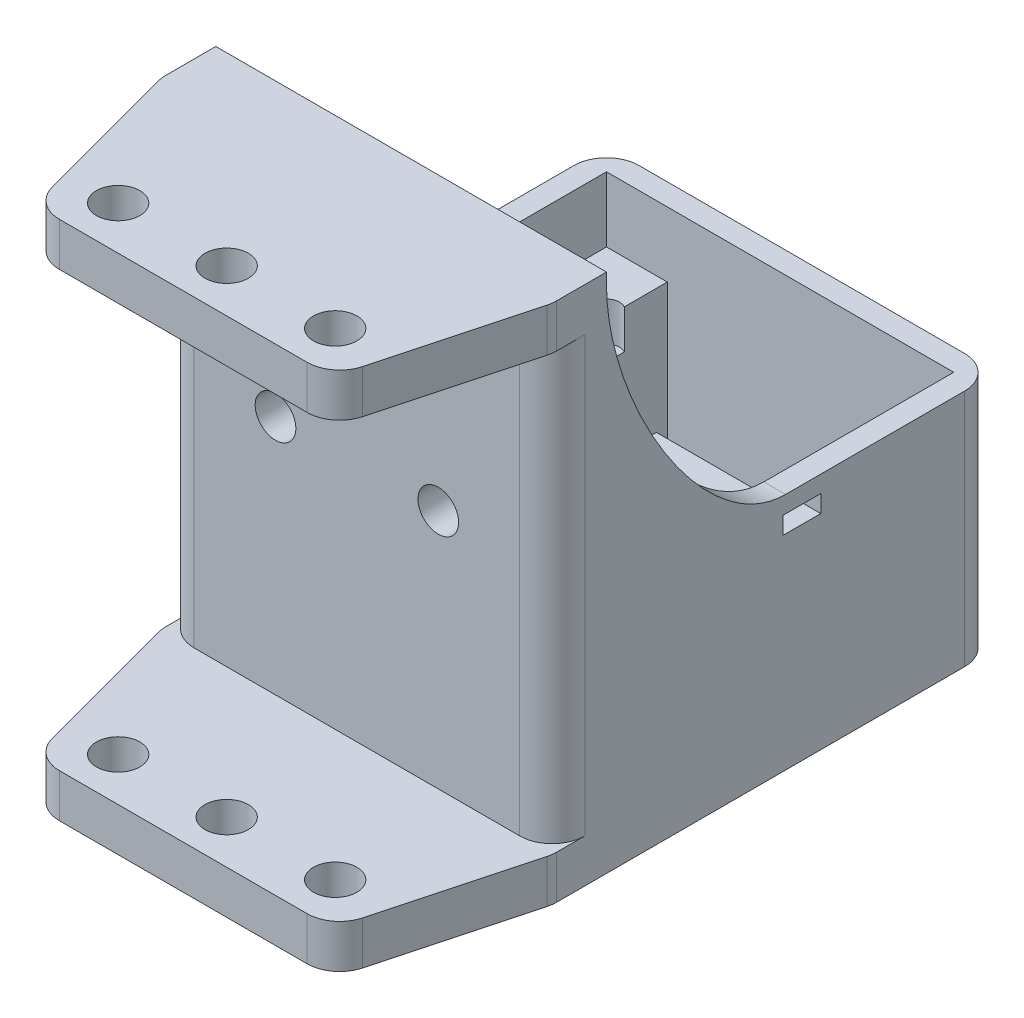
from build123d import *

# Parameters (mm, degrees)
SKETCH1_W           = 40.64
SKETCH1_H           = 40.64
BOSS_EXTRUDE1_DEPTH = 25.4
SHELL1_T            = 2.54
SKETCH2_W           = 7.112
SKETCH2_H           = 7.112
BOSS_EXTRUDE2_DEPTH = 17.78
BOSS_EXTRUDE3_DEPTH = 60.96
SKETCH5_W           = 20.32
SKETCH5_H           = 50.8
CUT_EXTRUDE1_DEPTH  = 90.198854813
SKETCH6_R           = 2.54
CUT_EXTRUDE2_DEPTH  = 82.804169209
FILLET1_R           = 3.81
SKETCH10_R          = 1.524
CUT_EXTRUDE4_DEPTH  = 4.572
CIRPATTERN1_COUNT   = 4
SKETCH11_R          = 7.3025
CUT_EXTRUDE5_DEPTH  = 80.929324406
RIB1_START          = -2.54
RIB1_DEPTH          = 2.54
SKETCH19_R          = 2.38125
CUT_EXTRUDE6_DEPTH  = 78.625990598
SKETCH20_W          = 2.032
SKETCH20_H          = 4.445
SKETCH7_W           = 38.1
SKETCH7_H           = 38.1
BOSS_EXTRUDE4_DEPTH = 3.175


with BuildPart() as part:
    # Sketch1 → Boss-Extrude1 (new body)
    with BuildSketch(Plane(origin=(0, 0, 0), x_dir=(1, 0, 0), z_dir=(0, 1, 0))):
        Rectangle(SKETCH1_W, SKETCH1_H)
    extrude(amount=BOSS_EXTRUDE1_DEPTH)

    # Shell1
    shell1_openings = [part.faces().sort_by_distance(p)[0] for p in [
        (0, 25.4, 0),
    ]]
    offset(amount=SHELL1_T, openings=shell1_openings, kind=Kind.INTERSECTION)

    # Sketch2 → Boss-Extrude2 (add)
    with BuildSketch(Plane(origin=(0, 0, 0), x_dir=(1, 0, 0), z_dir=(0, 1, 0))):
        with Locations((-16.764, 16.764)):
            Rectangle(SKETCH2_W, SKETCH2_H)
    boss_extrude2 = extrude(amount=BOSS_EXTRUDE2_DEPTH)

    # Sketch3 → Boss-Extrude3 (add)
    with BuildSketch(Plane.XZ.offset(2.54)):
        with BuildLine():
            Line((-22.730177398, 29.694504546), (-17.41527241, 49.53))
            Line((-17.41527241, 49.53), (17.41527241, 49.53))
            Line((17.41527241, 49.53), (22.730177398, 29.694504546))
            ThreePointArc((22.730177398, 29.694504546), (22.827404922, 29.205708777), (22.86, 28.708403984))
            Line((22.86, 28.708403984), (22.86, 22.86))
            Line((22.86, 22.86), (-22.86, 22.86))
            Line((-22.86, 22.86), (-22.86, 28.708403984))
            ThreePointArc((-22.86, 28.708403984), (-22.827404922, 29.205708777), (-22.730177398, 29.694504546))
        make_face()
    extrude(amount=-BOSS_EXTRUDE3_DEPTH)

    # Sketch5 → Cut-Extrude1 (cut, through all)
    with BuildSketch(Plane.ZY.offset(22.86)):
        with Locations((39.37, 27.94)):
            Rectangle(SKETCH5_W, SKETCH5_H)
    extrude(amount=-CUT_EXTRUDE1_DEPTH, mode=Mode.SUBTRACT)

    # Sketch6 → Cut-Extrude2 (cut, through all)
    with BuildSketch(Plane(origin=(0, 58.42, 0), x_dir=(1, 0, 0), z_dir=(0, 1, 0))):
        with Locations(Location((-12.7, -44.45, 0), (0, 0, 270))):
            Circle(SKETCH6_R)
        with Locations(Location((0, -44.45, 0), (0, 0, 270))):
            Circle(SKETCH6_R)
        with Locations(Location((12.7, -44.45, 0), (0, 0, 270))):
            Circle(SKETCH6_R)
    extrude(amount=-CUT_EXTRUDE2_DEPTH, mode=Mode.SUBTRACT)

    # Fillet1
    # the kernel refuses this fillet: 3.81 mm, written as the material it takes off along each edge
    with BuildSketch(Plane(origin=(-17.41527241, 46.03121044, 49.53), x_dir=(-0.25881904510252424, 0, -0.9659258262890673), z_dir=(0, 1, 0)), Plane(origin=(17.41527241, 46.03121044, 49.53), x_dir=(-1, 0, 0), z_dir=(0, 1, 0)), Plane(origin=(-17.41527241, -9.84878956, 49.53), x_dir=(-0.25881904510252424, 0, -0.9659258262890673), z_dir=(0, 1, 0)), Plane(origin=(17.41527241, -9.84878956, 49.53), x_dir=(-1, 0, 0), z_dir=(0, 1, 0))) as fillet1_piece_1:
        with BuildLine():
            CenterArc((FILLET1_R * 0.767326987979, -FILLET1_R), FILLET1_R, 90, 75)
            Line((-FILLET1_R * 0.19859883831, -FILLET1_R * 0.741180954897), (0, 0))
            Line((0, 0), (FILLET1_R * 0.767326987979, 0))
        make_face()
    extrude(amount=19.697579121, mode=Mode.SUBTRACT)
    with BuildSketch(Plane(origin=(-22.826837491, 53.34, 29.21), x_dir=(-0.008703740786851863, 0, -0.999962121730776), z_dir=(0, -1, 0))) as fillet1_piece_2:
        with BuildLine():
            CenterArc((3.776983069, 3.809855684), FILLET1_R, 180.49869391, 90)
            Line((-0.032872615, 3.776694431), (-0.413858183, 3.773378306))
            Line((-0.413858183, 3.773378306), (-0.380985568, -0.003316125))
            Line((-0.380985568, -0.003316125), (-0.04687044, -0.378106019))
            ThreePointArc((-0.04687044, -0.378106019), (0.505181779, -0.409781059), (3.813460447, -0.380985568))
            Line((3.813460447, -0.380985568), (3.810144322, 0))
        make_face()
    extrude(amount=50.8, mode=Mode.SUBTRACT)
    with BuildSketch(Plane(origin=(22.826837491, 53.34, 29.21), x_dir=(0.008703740786853719, 0, -0.999962121730776), z_dir=(0, -1, 0))) as fillet1_piece_3:
        with BuildLine():
            CenterArc((3.776983069, -3.809855684), FILLET1_R, 89.50130609, 90)
            Line((-0.032872615, -3.776694431), (-0.413858183, -3.773378306))
            Line((-0.413858183, -3.773378306), (-0.380985568, 0.003316125))
            Line((-0.380985568, 0.003316125), (-0.04687044, 0.378106019))
            ThreePointArc((-0.04687044, 0.378106019), (0.505181779, 0.409781059), (3.813460447, 0.380985568))
            Line((3.813460447, 0.380985568), (3.810144322, 0))
        make_face()
    extrude(amount=50.8, mode=Mode.SUBTRACT)
    with BuildSketch(Plane(origin=(-22.86, -12.065, -22.86), x_dir=(1, 0, 0), z_dir=(0, 1, 0))) as fillet1_piece_4:
        with BuildLine():
            CenterArc((FILLET1_R, -FILLET1_R), FILLET1_R, 90, 90)
            Line((0, -FILLET1_R), (0, 0))
            Line((0, 0), (FILLET1_R, 0))
        make_face()
    extrude(amount=46.99, mode=Mode.SUBTRACT)
    with BuildSketch(Plane(origin=(22.86, -12.065, -22.86), x_dir=(-1, 0, 0), z_dir=(0, 1, 0))) as fillet1_piece_5:
        with BuildLine():
            CenterArc((FILLET1_R, FILLET1_R), FILLET1_R, 180, 90)
            Line((0, FILLET1_R), (0, 0))
            Line((0, 0), (FILLET1_R, 0))
        make_face()
    extrude(amount=46.99, mode=Mode.SUBTRACT)

    # Sketch10 → Cut-Extrude4 (cut)
    with BuildSketch(Plane.XZ.offset(-13.208)):
        with Locations((-13.97, -13.97)):
            Circle(SKETCH10_R)
    cut_extrude4 = extrude(amount=-CUT_EXTRUDE4_DEPTH, mode=Mode.SUBTRACT)

    # CirPattern1: Boss-Extrude2, Cut-Extrude4 ×4 about axis
    cirpattern1_axis = Axis((0, 0, 0), (0, 1, 0))
    add([boss_extrude2.rotate(cirpattern1_axis, i * 360 / CIRPATTERN1_COUNT) for i in range(1, CIRPATTERN1_COUNT)])
    add([cut_extrude4.rotate(cirpattern1_axis, i * 360 / CIRPATTERN1_COUNT) for i in range(1, CIRPATTERN1_COUNT)], mode=Mode.SUBTRACT)

    # Sketch11 → Cut-Extrude5 (cut, through all)
    with BuildSketch(Plane(origin=(0, 0, 0), x_dir=(1, 0, 0), z_dir=(0, 1, 0))):
        with Locations(Location((0, 0, 0), (0, 0, 270))):
            Circle(SKETCH11_R)
    extrude(amount=-CUT_EXTRUDE5_DEPTH, mode=Mode.SUBTRACT)

    # Sketch12 → Revolve1 (revolve)
    with BuildSketch(Plane.XY, mode=Mode.PRIVATE) as revolve1_sk:
        Polygon((-11.1125, -2.54), (-11.1125, -5.08), (-7.3025, -2.54), align=None)
    revolve(revolve1_sk.sketch.rotate(Axis((0, 12.66825, 0), (0, -1, 0)), 270), axis=Axis((0, 12.66825, 0), (0, -1, 0)))

    # Rib1: read off the stored shape, not the designer's step
    # Rib1 outline → Rib1 (add)
    with BuildSketch(Plane.ZY.offset(22.86).offset(RIB1_START)):
        with BuildLine():
            add(Edge.make_bspline(
                [(1.905, 25.4), (11.363397975, 25.4), (22.86, 44.45), (22.86, 57.15)],
                knots=[0, 0, 0, 0, 1, 1, 1, 1], degree=3))
            Line((1.905, 25.4), (22.86, 25.4))
            Line((22.86, 25.4), (22.86, 57.15))
        make_face()
    rib1 = extrude(amount=RIB1_DEPTH)

    # Mirror2: Rib1 across plane
    add(rib1.mirror(Plane(origin=(0, 0, 0), x_dir=(0, 0, 1), z_dir=(1, 0, 0))))

    # Sketch19 → Cut-Extrude6 (cut, through all)
    with BuildSketch(Plane(origin=(0, 0, 22.86), x_dir=(-1, 0, 0), z_dir=(0, 0, -1))):
        with Locations((-9.525, 30.734)):
            Circle(SKETCH19_R)
        with Locations((9.525, 30.734)):
            Circle(SKETCH19_R)
        with Locations((0, 47.231783942)):
            Circle(SKETCH19_R)
    extrude(amount=-CUT_EXTRUDE6_DEPTH, mode=Mode.SUBTRACT)

    # Cut-Sweep1: sweep along a path in Sketch21
    with BuildLine() as cut_sweep1_path:  # in the path sketch's own coordinates; laid on its plane below (add() does not lay a ready-made edge on the line's plane)
        Line((-22.86, 22.4155), (-19.05, 22.4155))
        add(Edge.make_bspline(
            [(-19.05, 22.4155), (-16.933333333, 22.4155), (-15.24, 23.791333333), (-15.24, 25.273)],
            knots=[0, 0, 0, 0, 1, 1, 1, 1], degree=3))
    # Sketch20 → Cut-Sweep1 (sweep, cut)
    with BuildSketch(Plane(origin=(0, 25.273, 0), x_dir=(1, 0, 0), z_dir=(0, 1, 0))):
        with Locations((-15.24, 0)):
            Rectangle(SKETCH20_W, SKETCH20_H)
    cut_sweep1 = sweep(path=Plane.XY * cut_sweep1_path.line, mode=Mode.SUBTRACT)

    # Mirror4: Cut-Sweep1 across plane
    add(cut_sweep1.mirror(Plane(origin=(0, 0, 0), x_dir=(0, 0, 1), z_dir=(1, 0, 0))), mode=Mode.SUBTRACT)


with BuildPart() as body_2:
    # Sketch7 → Boss-Extrude4 (new body)
    with BuildSketch(Plane(origin=(0, 0, 0), x_dir=(1, 0, 0), z_dir=(0, 1, 0))):
        Rectangle(SKETCH7_W, SKETCH7_H)
    extrude(amount=BOSS_EXTRUDE4_DEPTH)


solid = Compound([part.part, body_2.part])
